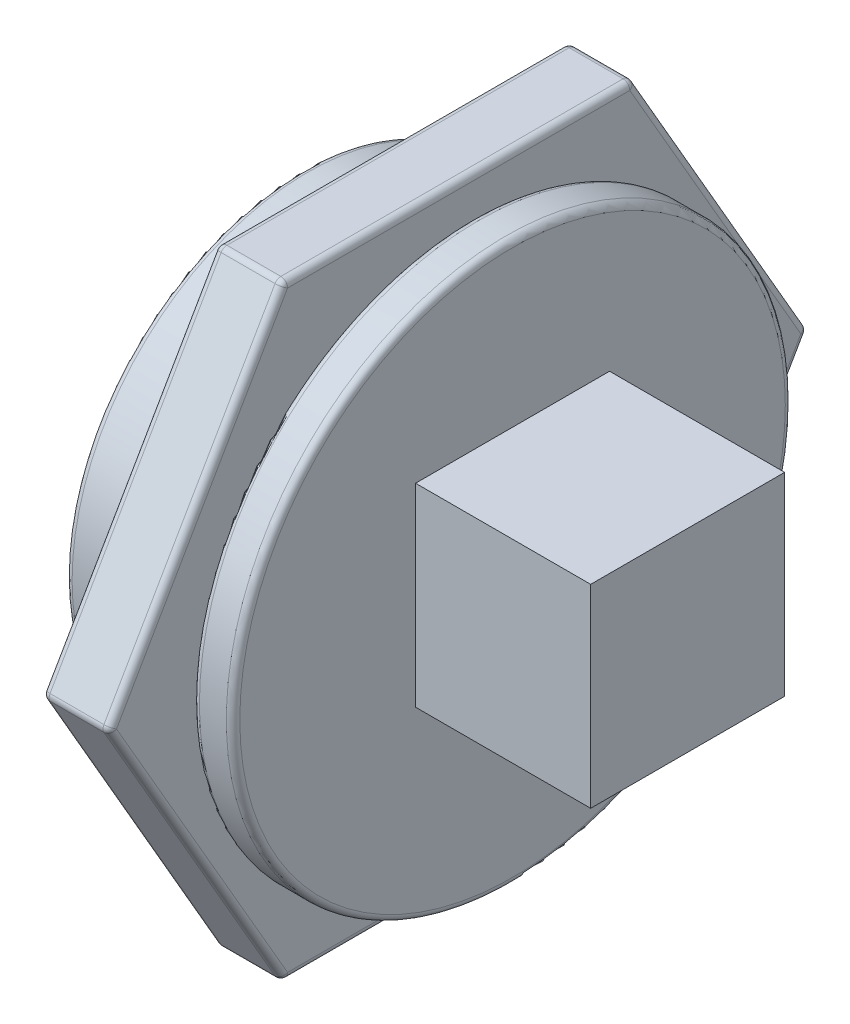
from build123d import *

# Parameters (mm, degrees)
BOSS_EXTRU_1_START      = 1
BOSS_EXTRU_1_DEPTH      = 5
ESQUISSE3_W             = 14.4
ESQUISSE3_H             = 14.4
BOSS_EXTRU_2_DEPTH      = 13
CONG_1_R                = 0.5
ESQUISSE4_W             = 14
ESQUISSE4_H             = 14
ENL_V_MAT_EXTRU_1_DEPTH = 16


with BuildPart() as part:
    # Esquisse1 → Révolution1 (revolve)
    with BuildSketch(Plane.XY, mode=Mode.PRIVATE) as r_volution1_sk:
        Polygon((-12.7, 0), (-12.7, 17.5), (0, 17.5), (0, 20.75), (3, 20.75), (3, 0), align=None)
    revolve(r_volution1_sk.sketch.rotate(Axis((15.223048327, 0, 0), (-1, 0, 0)), 90), axis=Axis((15.223048327, 0, 0), (-1, 0, 0)))

    # Esquisse2 → Boss.-Extru.1 (add)
    with BuildSketch(Plane.ZY.offset(BOSS_EXTRU_1_START)):
        Polygon((12.990381057, -22.5), (25.980762114, 0), (12.990381057, 22.5), (-12.990381057, 22.5), (-25.980762114, 0), (-12.990381057, -22.5), align=None)
    extrude(amount=BOSS_EXTRU_1_DEPTH)

    # Esquisse3 → Boss.-Extru.2 (add)
    with BuildSketch(Plane(origin=(3, 0, 0), x_dir=(0, 0, -1), z_dir=(1, 0, 0))):
        with Locations((0, 1.5)):
            Rectangle(ESQUISSE3_W, ESQUISSE3_H)
    extrude(amount=BOSS_EXTRU_2_DEPTH)

    # Congé1
    cong_1_edges = [part.edges().sort_by_distance(p)[0] for p in [
        (-1, 0, 17.5),
        (-1, -22.5, 0),
        (-3.5, -22.5, -12.990381057),
        (-1, -11.25, 19.485571585),
        (-3.5, -22.5, 12.990381057),
        (-1, 11.25, 19.485571585),
        (-3.5, 0, 25.980762114),
        (-1, 22.5, 0),
        (-3.5, 22.5, 12.990381057),
        (-1, 11.25, -19.485571585),
        (-3.5, 22.5, -12.990381057),
        (-1, -11.25, -19.485571585),
        (-3.5, 0, -25.980762114),
        (-6, -22.5, 0),
        (-6, -11.25, 19.485571585),
        (-6, 11.25, 19.485571585),
        (-6, 22.5, 0),
        (-6, 11.25, -19.485571585),
        (-6, -11.25, -19.485571585),
        (3, 0, 20.75),
        (0, 0, 20.75),
        (0, 0, 17.5),
        (-12.7, 0, 17.5),
    ]]
    fillet(cong_1_edges, radius=CONG_1_R - 0.0001)  # a hair under: the kernel refuses the full size

    # Esquisse4 → Enlèv. mat.-Extru.1 (cut)
    with BuildSketch(Plane.ZY.offset(12.7)):
        with Locations((0, 1.5)):
            Rectangle(ESQUISSE4_W, ESQUISSE4_H)
    extrude(amount=-ENL_V_MAT_EXTRU_1_DEPTH, mode=Mode.SUBTRACT)


solid = part.part
